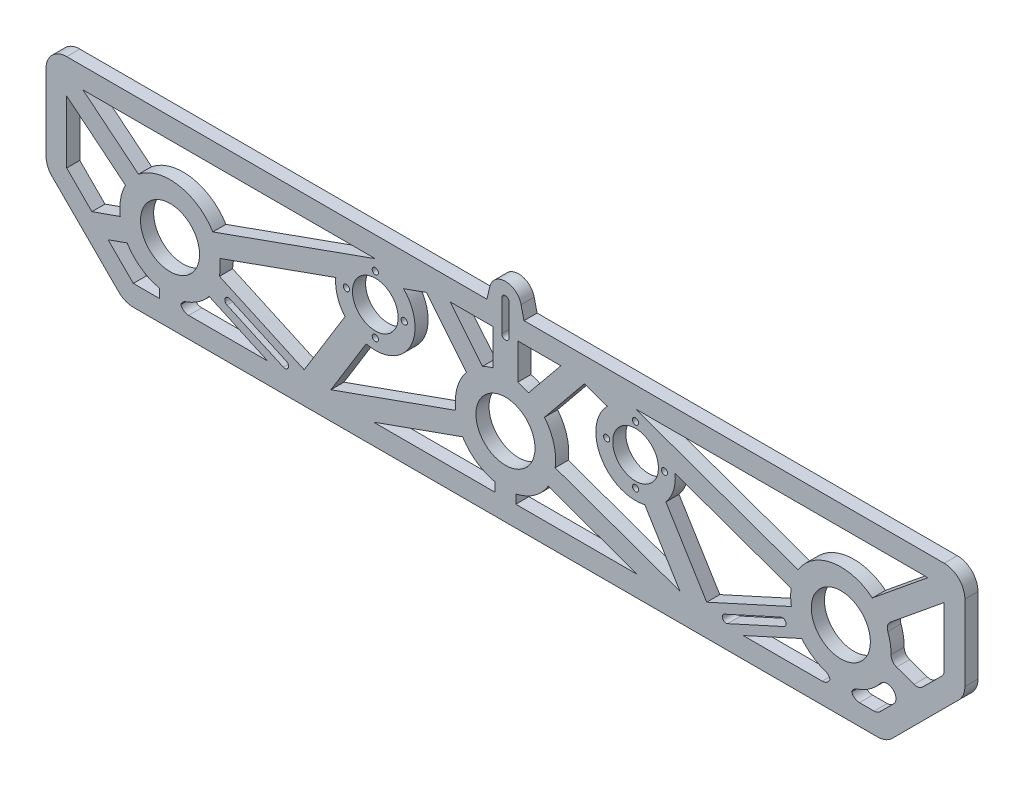
from build123d import *

# Parameters (mm, degrees)
SKETCH1_R           = 14.2875
SKETCH1_R_2         = 11.049
SKETCH1_R_3         = 1.5
BOSS_EXTRUDE1_DEPTH = 6.35
FILLET3_R           = 4
BOSS_EXTRUDE2_START = -6.35
BOSS_EXTRUDE2_DEPTH = 6.35
SKETCH3_R           = 1.778
BOSS_EXTRUDE3_DEPTH = 6.35
BOSS_EXTRUDE4_DEPTH = 6.35
BOSS_EXTRUDE5_START = -6.35
BOSS_EXTRUDE5_DEPTH = 6.35
CUT_EXTRUDE1_DEPTH  = 10


with BuildPart() as part:
    # Sketch1 → Boss-Extrude1 (new body)
    with BuildSketch(Plane.XY):
        with BuildLine():
            Line((2.928932188, 35.171067812), (35.171067812, 2.928932188))
            ThreePointArc((35.171067812, 2.928932188), (38.4153013, 0.761204675), (42.242135624, 0))
            Line((42.242135624, 0), (402.257864376, 0))
            ThreePointArc((402.257864376, 0), (406.0846987, 0.761204675), (409.328932188, 2.928932188))
            Line((409.328932188, 2.928932188), (441.571067812, 35.171067812))
            ThreePointArc((441.571067812, 35.171067812), (443.738795325, 38.4153013), (444.5, 42.242135624))
            Line((444.5, 42.242135624), (444.5, 78.9))
            ThreePointArc((444.5, 78.9), (441.571067812, 85.971067812), (434.5, 88.9))
            Line((434.5, 88.9), (10, 88.9))
            ThreePointArc((10, 88.9), (2.928932188, 85.971067812), (0, 78.9))
            Line((0, 78.9), (0, 42.242135624))
            ThreePointArc((0, 42.242135624), (0.761204675, 38.4153013), (2.928932188, 35.171067812))
        make_face()
        with Locations((60, 38.1)):
            Circle(SKETCH1_R, mode=Mode.SUBTRACT)
        with Locations((384.5, 38.1)):
            Circle(SKETCH1_R, mode=Mode.SUBTRACT)
        with Locations((222.25, 38.1)):
            Circle(SKETCH1_R, mode=Mode.SUBTRACT)
        with Locations((159.303289572, 59.685452953)):
            Circle(SKETCH1_R_2, mode=Mode.SUBTRACT)
        with Locations((159.303289572, 73.680852953)):
            Circle(SKETCH1_R_3, mode=Mode.SUBTRACT)
        with Locations((145.307889572, 59.685452953)):
            Circle(SKETCH1_R_3, mode=Mode.SUBTRACT)
        with Locations((159.303289572, 45.690052953)):
            Circle(SKETCH1_R_3, mode=Mode.SUBTRACT)
        with Locations((173.298689572, 59.685452953)):
            Circle(SKETCH1_R_3, mode=Mode.SUBTRACT)
        with Locations((285.196710428, 45.690052953)):
            Circle(SKETCH1_R_3, mode=Mode.SUBTRACT)
        with Locations((285.196710428, 73.680852953)):
            Circle(SKETCH1_R_3, mode=Mode.SUBTRACT)
        with Locations((271.201310428, 59.685452953)):
            Circle(SKETCH1_R_3, mode=Mode.SUBTRACT)
        with Locations((299.192110428, 59.685452953)):
            Circle(SKETCH1_R_3, mode=Mode.SUBTRACT)
        with Locations((285.196710428, 59.685452953)):
            Circle(SKETCH1_R_2, mode=Mode.SUBTRACT)
        with BuildLine():
            Line((42.242135624, 10), (55, 10))
            Line((55, 10), (55, 14.332739824))
            ThreePointArc((55, 14.332739824), (45.977844894, 18.269169901), (39.258984185, 25.463033624))
            Line((39.258984185, 25.463033624), (30.039080729, 22.203054895))
            Line((30.039080729, 22.203054895), (42.242135624, 10))
        make_face(mode=Mode.SUBTRACT)
        with BuildLine():
            Line((402.257864376, 10), (414.460919271, 22.203054895))
            Line((414.460919271, 22.203054895), (405.241015815, 25.463033624))
            ThreePointArc((405.241015815, 25.463033624), (398.522155106, 18.269169901), (389.5, 14.332739824))
            Line((389.5, 14.332739824), (389.5, 10))
            Line((389.5, 10), (402.257864376, 10))
        make_face(mode=Mode.SUBTRACT)
        with BuildLine():
            Line((434.5, 42.242135624), (434.5, 72.446597797))
            Line((434.5, 72.446597797), (406.075642814, 49.252322333))
            ThreePointArc((406.075642814, 49.252322333), (408.427959025, 42.263584169), (408.574576932, 34.891043503))
            Line((408.574576932, 34.891043503), (420.045712746, 30.835072751))
            Line((420.045712746, 30.835072751), (422.296945105, 30.039080729))
            Line((422.296945105, 30.039080729), (434.5, 42.242135624))
        make_face(mode=Mode.SUBTRACT)
        with BuildLine():
            Line((17.908581132, 78.9), (159.303289572, 78.9))
            Line((159.303289572, 78.9), (80.698128287, 50.807090212))
            ThreePointArc((80.698128287, 50.807090212), (64.123087075, 62.034970424), (44.746603764, 57.000173532))
            Line((44.746603764, 57.000173532), (17.908581132, 78.9))
        make_face(mode=Mode.SUBTRACT)
        with BuildLine():
            Line((10, 42.242135624), (10, 72.446597797))
            Line((10, 72.446597797), (38.424357186, 49.252322333))
            ThreePointArc((38.424357186, 49.252322333), (36.072040975, 42.263584169), (35.925423068, 34.891043503))
            Line((35.925423068, 34.891043503), (24.454287254, 30.835072751))
            Line((24.454287254, 30.835072751), (22.203054895, 30.039080729))
            Line((22.203054895, 30.039080729), (10, 42.242135624))
        make_face(mode=Mode.SUBTRACT)
        with BuildLine():
            Line((65, 14.332739824), (65, 10))
            Line((65, 10), (128.768147223, 10))
            Line((128.768147223, 10), (141.942274838, 14.708336864))
            Line((141.942274838, 14.708336864), (198.186421388, 34.809583517))
            ThreePointArc((198.186421388, 34.809583517), (198.85545044, 44.625159549), (203.363262878, 53.370030031))
            Line((203.363262878, 53.370030031), (185.140287975, 75.742288539))
            Line((185.140287975, 75.742288539), (184.022239752, 77.114910957))
            Line((184.022239752, 77.114910957), (175.842867511, 74.191663136))
            Line((175.842867511, 74.191663136), (172.989566623, 73.171914265))
            ThreePointArc((172.989566623, 73.171914265), (165.769849932, 41.591740915), (140.169215361, 61.442160745))
            Line((140.169215361, 61.442160745), (84.063578612, 41.390416483))
            ThreePointArc((84.063578612, 41.390416483), (79.854530137, 24.1114229), (65, 14.332739824))
        make_face(mode=Mode.SUBTRACT)
        with BuildLine():
            Line((399.753396236, 57.000173532), (426.591418868, 78.9))
            Line((426.591418868, 78.9), (285.196710428, 78.9))
            Line((285.196710428, 78.9), (363.801871713, 50.807090212))
            ThreePointArc((363.801871713, 50.807090212), (380.376912925, 62.034970424), (399.753396236, 57.000173532))
        make_face(mode=Mode.SUBTRACT)
        with BuildLine():
            Line((158.481852777, 10), (201.551871713, 25.392909788))
            ThreePointArc((201.551871713, 25.392909788), (208.2614229, 18.245469863), (217.25, 14.332739824))
            Line((217.25, 14.332739824), (217.25, 10))
            Line((217.25, 10), (158.481852777, 10))
        make_face(mode=Mode.SUBTRACT)
        with BuildLine():
            Line((195.465766991, 78.9), (211.116677179, 59.685452953))
            ThreePointArc((211.116677179, 59.685452953), (222.25, 62.3875), (233.383322821, 59.685452953))
            Line((233.383322821, 59.685452953), (249.034233009, 78.9))
            Line((249.034233009, 78.9), (195.465766991, 78.9))
        make_face(mode=Mode.SUBTRACT)
        with BuildLine():
            Line((379.5, 14.332739824), (379.5, 10))
            Line((379.5, 10), (315.731852777, 10))
            Line((315.731852777, 10), (302.557725162, 14.708336864))
            Line((302.557725162, 14.708336864), (246.313578612, 34.809583517))
            ThreePointArc((246.313578612, 34.809583517), (245.64454956, 44.625159549), (241.136737122, 53.370030031))
            Line((241.136737122, 53.370030031), (259.359712025, 75.742288539))
            Line((259.359712025, 75.742288539), (260.477760248, 77.114910957))
            Line((260.477760248, 77.114910957), (268.657132489, 74.191663136))
            Line((268.657132489, 74.191663136), (271.510433377, 73.171914265))
            ThreePointArc((271.510433377, 73.171914265), (278.730150068, 41.591740915), (304.330784639, 61.442160745))
            Line((304.330784639, 61.442160745), (360.436421388, 41.390416483))
            ThreePointArc((360.436421388, 41.390416483), (364.645469863, 24.1114229), (379.5, 14.332739824))
        make_face(mode=Mode.SUBTRACT)
        with BuildLine():
            Line((286.018147223, 10), (227.25, 10))
            Line((227.25, 10), (227.25, 14.332739824))
            ThreePointArc((227.25, 14.332739824), (236.2385771, 18.245469863), (242.948128287, 25.392909788))
            Line((242.948128287, 25.392909788), (286.018147223, 10))
        make_face(mode=Mode.SUBTRACT)
    extrude(amount=BOSS_EXTRUDE1_DEPTH)

    # Fillet3
    # the kernel refuses this fillet: 4 mm, written as the material it adds along each edge
    with BuildSketch(Plane(origin=(434.5, 42.242135624, 0), x_dir=(0, 1, 0), z_dir=(0, 0, 1))) as fillet3_piece_1:
        with BuildLine():
            CenterArc((FILLET3_R * 0.414213562373, FILLET3_R), FILLET3_R, 225, 45)
            Line((-FILLET3_R * 0.292893218813, FILLET3_R * 0.292893218813), (0, 0))
            Line((0, 0), (FILLET3_R * 0.414213562373, 0))
        make_face()
    extrude(amount=6.35)
    with BuildSketch(Plane(origin=(422.296945105, 30.039080729, 0), x_dir=(-0.9428009879202438, 0.33335611165330736, 0), z_dir=(0, 0, 1))) as fillet3_piece_2:
        with BuildLine():
            CenterArc((FILLET3_R * 0.630618821441, -FILLET3_R), FILLET3_R, 90, 64.47260491)
            Line((-FILLET3_R * 0.271760517527, -FILLET3_R * 0.569057395232), (0, 0))
            Line((0, 0), (FILLET3_R * 0.630618821441, 0))
        make_face()
    extrude(amount=6.35)
    with BuildSketch(Plane(origin=(408.574576932, 34.891043503, 0), x_dir=(0.07422292500138471, 0.9972416745223992, 0), z_dir=(0, 0, 1))) as fillet3_piece_3:
        with BuildLine():
            CenterArc((3.059187738, -3.993222777), FILLET3_R, 93.335760439, 71.44820939)
            Line((-0.800584668, -2.943386137), (0, 0))
            ThreePointArc((0, 0), (1.413219633, -0.04115045), (2.826439265, 0))
        make_face()
    extrude(amount=6.35)
    with BuildSketch(Plane(origin=(406.075642814, 49.252322333, 0), x_dir=(0.774785119901029, 0.632224657839243, 0), z_dir=(0, 0, 1)), Plane(origin=(405.241015815, 25.463033624, 0), x_dir=(0.942800987920241, -0.3333561116533152, 0), z_dir=(0, 0, 1)), Plane(origin=(379.5, 14.332739824, 0), x_dir=(0, -1, 0), z_dir=(0, 0, 1))) as fillet3_piece_4:
        with BuildLine():
            CenterArc((3.050320928, -4), FILLET3_R, 90, 71.44820939)
            ThreePointArc((-0.741824875, -2.727353071), (-0.331204595, -1.374476848), (0, 0))
            Line((0, 0), (3.050320928, 0))
        make_face()
    extrude(amount=6.35)
    with BuildSketch(Plane(origin=(414.460919271, 22.203054895, 0), x_dir=(-0.7071067811865716, -0.7071067811865235, 0), z_dir=(0, 0, 1))) as fillet3_piece_5:
        with BuildLine():
            CenterArc((FILLET3_R * 1.58574398036, -FILLET3_R), FILLET3_R, 90, 115.52739509)
            Line((FILLET3_R * 0.68336464139, -FILLET3_R * 1.43094260477), (0, 0))
            Line((0, 0), (FILLET3_R * 1.58574398036, 0))
        make_face()
    extrude(amount=6.35)
    with BuildSketch(Plane(origin=(402.257864376, 10, 0), x_dir=(-1, 0, 0), z_dir=(0, 0, 1))) as fillet3_piece_6:
        with BuildLine():
            CenterArc((FILLET3_R * 0.414213562373, -FILLET3_R), FILLET3_R, 90, 45)
            Line((-FILLET3_R * 0.292893218813, -FILLET3_R * 0.292893218813), (0, 0))
            Line((0, 0), (FILLET3_R * 0.414213562373, 0))
        make_face()
    extrude(amount=6.35)
    with BuildSketch(Plane(origin=(389.5, 10, 0), x_dir=(0, 1, 0), z_dir=(0, 0, 1)), Plane(origin=(65, 10, 0), x_dir=(0, 1, 0), z_dir=(0, 0, 1)), Plane(origin=(379.5, 10, 0), x_dir=(-1, 0, 0), z_dir=(0, 0, 1))) as fillet3_piece_7:
        with BuildLine():
            CenterArc((FILLET3_R, -FILLET3_R), FILLET3_R, 90, 90)
            Line((0, -FILLET3_R), (0, 0))
            Line((0, 0), (FILLET3_R, 0))
        make_face()
    extrude(amount=6.35)
    with BuildSketch(Plane(origin=(389.5, 14.332739824, 0), x_dir=(0, -1, 0), z_dir=(0, 0, 1)), Plane(origin=(65, 14.332739824, 0), x_dir=(0, -1, 0), z_dir=(0, 0, 1))) as fillet3_piece_8:
        with BuildLine():
            CenterArc((3.050320928, 4), FILLET3_R, 198.55179061, 71.44820939)
            ThreePointArc((-0.741824875, 2.727353071), (-0.331204595, 1.374476848), (0, 0))
            Line((0, 0), (3.050320928, 0))
        make_face()
    extrude(amount=6.35)

    # Sketch2 → Boss-Extrude2 (add)
    with BuildSketch(Plane.XY.offset(6.35).offset(BOSS_EXTRUDE2_START)):
        with BuildLine():
            Line((216.25, 62.3875), (216.25, 61.634711731))
            ThreePointArc((216.25, 61.634711731), (222.25, 62.3875), (228.25, 61.634711731))
            Line((228.25, 61.634711731), (228.25, 62.3875))
            Line((228.25, 62.3875), (228.25, 78.9))
            Line((228.25, 78.9), (216.25, 78.9))
            Line((216.25, 78.9), (216.25, 62.3875))
        make_face()
    extrude(amount=BOSS_EXTRUDE2_DEPTH)

    # Sketch3 → Boss-Extrude3 (add)
    # profile 1 of 3: a face of its own
    with BuildSketch(Plane.XY.offset(6.35)):
        with BuildLine():
            ThreePointArc((230.028, 93.1), (229.976341925, 93.994943826), (229.822053883, 94.878))
            ThreePointArc((229.822053883, 94.878), (222.25, 100.878), (214.677946117, 94.878))
            ThreePointArc((214.677946117, 94.878), (216.153830383, 88.269472079), (222.25, 85.322))
            Line((222.25, 85.322), (223.732756765, 85.46464039))
            ThreePointArc((223.732756765, 85.46464039), (228.25125679, 88.152050835), (230.028, 93.1))
        make_face()
        with Locations((222.25, 93.1)):
            Circle(SKETCH3_R, mode=Mode.SUBTRACT)
    # profile 2 of 3: a face of its own
    with BuildSketch(Plane.XY.offset(6.35)):
        with BuildLine():
            ThreePointArc((222.25, 85.322), (216.153830383, 88.269472079), (214.677946117, 94.878))
            Line((214.677946117, 94.878), (212.43409415, 85.322))
            Line((212.43409415, 85.322), (222.25, 85.322))
        make_face()
    # profile 3 of 3: a face of its own
    with BuildSketch(Plane.XY.offset(6.35)):
        with BuildLine():
            Line((231.849075499, 86.245425813), (229.822053883, 94.878))
            ThreePointArc((229.822053883, 94.878), (229.976341925, 93.994943826), (230.028, 93.1))
            ThreePointArc((230.028, 93.1), (228.25125679, 88.152050835), (223.732756765, 85.46464039))
            Line((223.732756765, 85.46464039), (231.849075499, 86.245425813))
        make_face()
    extrude(amount=-BOSS_EXTRUDE3_DEPTH)

    # Sketch5 → Boss-Extrude4 (add)
    # profile 1 of 4: a face of its own
    with BuildSketch(Plane(origin=(0, 0, 0), x_dir=(-1, 0, 0), z_dir=(0, 0, -1))):
        with BuildLine():
            Line((-299.866054416, 47.275410038), (-320.843662597, 13.14156018))
            Line((-320.843662597, 13.14156018), (-322.774368298, 10))
            Line((-322.774368298, 10), (-315.731852777, 10))
            Line((-315.731852777, 10), (-306.707123182, 13.225372357))
            Line((-306.707123182, 13.225372357), (-289.642434776, 40.992289678))
            ThreePointArc((-289.642434776, 40.992289678), (-295.25731974, 43.315267907), (-299.866054416, 47.275410038))
        make_face()
        with BuildLine():
            ThreePointArc((-310.304133359, 15.435983537), (-312.749882002, 14.852132894), (-313.333732646, 17.297881537))
            Line((-313.333732646, 17.297881537), (-298.673118473, 41.152994031))
            ThreePointArc((-298.673118473, 41.152994031), (-296.22736983, 41.736844674), (-295.643519186, 39.291096031))
            Line((-295.643519186, 39.291096031), (-310.304133359, 15.435983537))
        make_face(mode=Mode.SUBTRACT)
    # profile 2 of 4: a face of its own
    with BuildSketch(Plane(origin=(0, 0, 0), x_dir=(-1, 0, 0), z_dir=(0, 0, -1))):
        with BuildLine():
            Line((-121.725631702, 10), (-123.656337403, 13.14156018))
            Line((-123.656337403, 13.14156018), (-144.633945584, 47.275410038))
            ThreePointArc((-144.633945584, 47.275410038), (-149.24268026, 43.315267907), (-154.857565224, 40.992289678))
            Line((-154.857565224, 40.992289678), (-137.792876818, 13.225372357))
            Line((-137.792876818, 13.225372357), (-128.768147223, 10))
            Line((-128.768147223, 10), (-121.725631702, 10))
        make_face()
        with BuildLine():
            ThreePointArc((-131.166267354, 17.297881537), (-131.750117998, 14.852132894), (-134.195866641, 15.435983537))
            Line((-134.195866641, 15.435983537), (-148.856480814, 39.291096031))
            ThreePointArc((-148.856480814, 39.291096031), (-148.27263017, 41.736844674), (-145.826881527, 41.152994031))
            Line((-145.826881527, 41.152994031), (-131.166267354, 17.297881537))
        make_face(mode=Mode.SUBTRACT)
    # profile 3 of 4: a face of its own
    with BuildSketch(Plane(origin=(0, 0, 0), x_dir=(-1, 0, 0), z_dir=(0, 0, -1))):
        with BuildLine():
            Line((-131.166267354, 17.297881537), (-145.826881527, 41.152994031))
            ThreePointArc((-145.826881527, 41.152994031), (-148.27263017, 41.736844674), (-148.856480814, 39.291096031))
            Line((-148.856480814, 39.291096031), (-134.195866641, 15.435983537))
            ThreePointArc((-134.195866641, 15.435983537), (-131.750117998, 14.852132894), (-131.166267354, 17.297881537))
        make_face()
    # profile 4 of 4: a face of its own
    with BuildSketch(Plane(origin=(0, 0, 0), x_dir=(-1, 0, 0), z_dir=(0, 0, -1))):
        with BuildLine():
            Line((-310.304133359, 15.435983537), (-295.643519186, 39.291096031))
            ThreePointArc((-295.643519186, 39.291096031), (-296.22736983, 41.736844674), (-298.673118473, 41.152994031))
            Line((-298.673118473, 41.152994031), (-313.333732646, 17.297881537))
            ThreePointArc((-313.333732646, 17.297881537), (-312.749882002, 14.852132894), (-310.304133359, 15.435983537))
        make_face()
    extrude(amount=-BOSS_EXTRUDE4_DEPTH)

    # Sketch6 → Boss-Extrude5 (add)
    # profile 1 of 2: a face of its own
    with BuildSketch(Plane.XY.offset(6.35).offset(BOSS_EXTRUDE5_START)):
        with BuildLine():
            ThreePointArc((83.905563976, 33.809700798), (82.104735429, 28.037031855), (78.933639416, 22.888163993))
            Line((78.933639416, 22.888163993), (107.244317849, 10))
            Line((107.244317849, 10), (121.725631702, 10))
            Line((121.725631702, 10), (124.891444678, 15.151272913))
            Line((124.891444678, 15.151272913), (124.211593982, 15.460768402))
            Line((124.211593982, 15.460768402), (83.905563976, 33.809700798))
        make_face()
        with BuildLine():
            ThreePointArc((87.526589071, 23.615213924), (86.645054856, 25.970095116), (88.999936048, 26.85162933))
            Line((88.999936048, 26.85162933), (116.30377806, 14.421817931))
            ThreePointArc((116.30377806, 14.421817931), (117.185312274, 12.066936739), (114.830431082, 11.185402525))
            Line((114.830431082, 11.185402525), (87.526589071, 23.615213924))
        make_face(mode=Mode.SUBTRACT)
    # profile 2 of 2: a face of its own
    with BuildSketch(Plane.XY.offset(6.35).offset(BOSS_EXTRUDE5_START)):
        with BuildLine():
            Line((365.566360584, 22.888163993), (337.255682151, 10))
            Line((337.255682151, 10), (322.774368298, 10))
            Line((322.774368298, 10), (319.608555322, 15.151272913))
            Line((319.608555322, 15.151272913), (320.288406018, 15.460768402))
            Line((320.288406018, 15.460768402), (360.594436024, 33.809700798))
            ThreePointArc((360.594436024, 33.809700798), (362.395264571, 28.037031855), (365.566360584, 22.888163993))
        make_face()
        with BuildLine():
            Line((356.973410929, 23.615213924), (329.669568918, 11.185402525))
            ThreePointArc((329.669568918, 11.185402525), (327.314687726, 12.066936739), (328.19622194, 14.421817931))
            Line((328.19622194, 14.421817931), (355.500063952, 26.85162933))
            ThreePointArc((355.500063952, 26.85162933), (357.854945144, 25.970095116), (356.973410929, 23.615213924))
        make_face(mode=Mode.SUBTRACT)
    extrude(amount=BOSS_EXTRUDE5_DEPTH)

    # Sketch7 → Cut-Extrude1 (cut)
    with BuildSketch(Plane.XY.offset(6.35)):
        with BuildLine():
            Line((224.028, 93.1), (224.028, 78.1))
            ThreePointArc((224.028, 78.1), (222.25, 76.322), (220.472, 78.1))
            Line((220.472, 78.1), (220.472, 93.1))
            ThreePointArc((220.472, 93.1), (222.25, 94.878), (224.028, 93.1))
        make_face()
    extrude(amount=-CUT_EXTRUDE1_DEPTH, mode=Mode.SUBTRACT)


solid = part.part
